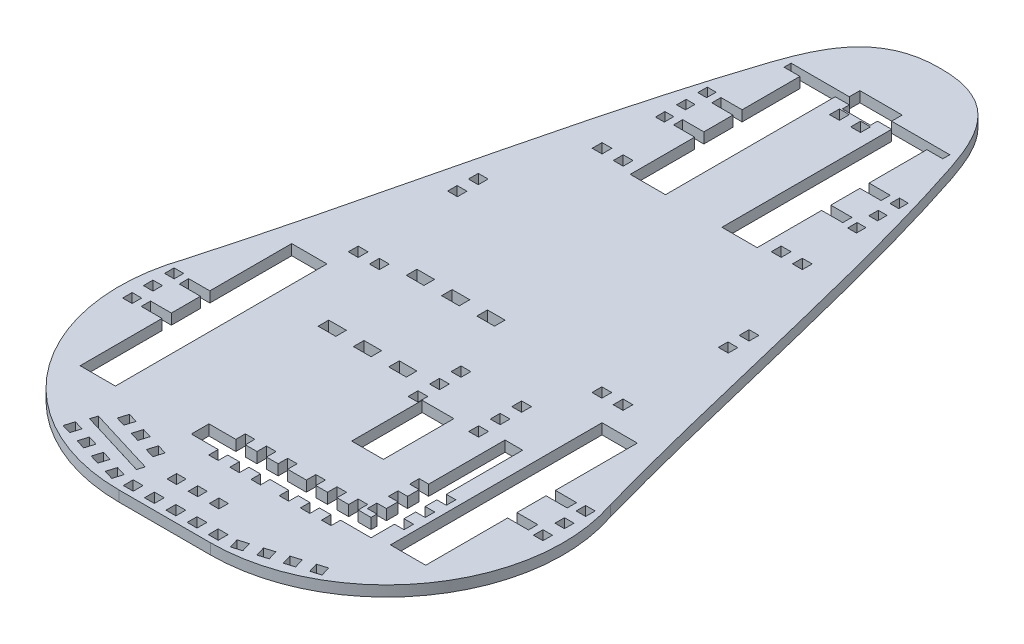
from build123d import *

# Parameters (mm, degrees)
SKETCH1_W           = 2.8
SKETCH1_H           = 2.8
SKETCH1_W_2         = 2.7
SKETCH1_H_2         = 2.7
SKETCH1_W_3         = 5
SKETCH1_H_3         = 3
SKETCH1_W_4         = 9
SKETCH1_H_4         = 20
SKETCH1_W_5         = 2.800000003
SKETCH1_H_5         = 2.800000033
SKETCH1_W_6         = 2.5
BOSS_EXTRUDE1_DEPTH = 3


with BuildPart() as part:
    # Sketch1 → Boss-Extrude1 (new body)
    with BuildSketch(Plane(origin=(0, 0, 0), x_dir=(1, 0, 0), z_dir=(0, 1, 0))):
        with BuildLine():
            ThreePointArc((-5.451969155, 56.808087392), (1.269227402, 11.627256864), (41.903464762, -9.237562441))
            Line((41.903464762, -9.237562441), (44.871962037, -9.237562441))
            Line((44.871962037, -9.237562441), (54.871962037, -9.237562441))
            Line((54.871962037, -9.237562441), (64.871962037, -9.237562441))
            Line((64.871962037, -9.237562441), (67.840459312, -9.237562441))
            ThreePointArc((67.840459312, -9.237562441), (108.474696672, 11.627256864), (115.195893229, 56.808087392))
            add(Edge.make_bspline(
                [(54.871962037, 210.762437559), (55.761906822, 210.762437559), (73.060866, 210.353019152), (83.092202828, 181.760771438), (97.272204063, 130.317751313), (107.073407346, 85.556993843), (115.195893229, 56.808087392)],
                knots=[0, 0, 0, 0, 0.011071988, 0.221439755, 0.460221349, 1, 1, 1, 1], degree=3))
            add(Edge.make_bspline(
                [(54.871962037, 210.762437559), (53.982017252, 210.762437559), (36.683058074, 210.353019152), (26.651721246, 181.760771438), (12.471720011, 130.317751313), (2.670516728, 85.556993843), (-5.451969155, 56.808087392)],
                knots=[0, 0, 0, 0, 0.011071988, 0.221439755, 0.460221349, 1, 1, 1, 1], degree=3))
        make_face()
        Polygon((18.148901926, -1.344832715), (18.967542699, 1.332820601), (21.645196015, 0.514179828), (20.826555242, -2.163473489), align=None, mode=Mode.SUBTRACT)
        Polygon((23.886730461, -3.099062944), (24.705371235, -0.421409627), (27.383024551, -1.2400504), (26.564383778, -3.917703717), align=None, mode=Mode.SUBTRACT)
        Polygon((20.227179715, 4.084786187), (20.811923125, 5.997395699), (39.938018244, 0.149961605), (39.353274835, -1.762647907), align=None, mode=Mode.SUBTRACT)
        Polygon((30.44319977, -2.175639855), (33.120853087, -2.994280629), (32.302212314, -5.671933945), (29.624558997, -4.853293172), align=None, mode=Mode.SUBTRACT)
        Polygon((38.858681623, -4.748510857), (38.04004085, -7.426164174), (35.362387533, -6.6075234), (36.181028306, -3.929870084), align=None, mode=Mode.SUBTRACT)
        Polygon((23.984169653, 8.164617876), (24.802810426, 10.842271193), (27.480463743, 10.023630419), (26.66182297, 7.345977103), align=None, mode=Mode.SUBTRACT)
        Polygon((29.721998189, 6.410387647), (30.540638962, 9.088040964), (33.218292279, 8.269400191), (32.399651506, 5.591746874), align=None, mode=Mode.SUBTRACT)
        Polygon((36.6609894, 7.216862054), (39.338642717, 6.398221281), (38.520001944, 3.720567964), (35.842348627, 4.539208737), align=None, mode=Mode.SUBTRACT)
        with Locations((42.821962037, -6.137562811)):
            Rectangle(SKETCH1_W, SKETCH1_H, mode=Mode.SUBTRACT)
        with Locations((48.821962037, -6.137562811)):
            Rectangle(SKETCH1_W, SKETCH1_H, mode=Mode.SUBTRACT)
        with Locations((47.371962075, 1.612437189)):
            Rectangle(SKETCH1_W_2, SKETCH1_H_2, mode=Mode.SUBTRACT)
        with Locations((53.371962075, 1.612437189)):
            Rectangle(SKETCH1_W_2, SKETCH1_H_2, mode=Mode.SUBTRACT)
        with Locations((-3.378903903, 39.762437559)):
            Rectangle(SKETCH1_W_2, SKETCH1_H_2, mode=Mode.SUBTRACT)
        with Locations((-3.478037963, 45.762437559)):
            Rectangle(SKETCH1_W_2, SKETCH1_H_2, mode=Mode.SUBTRACT)
        with Locations((-3.478037963, 51.762437559)):
            Rectangle(SKETCH1_W_2, SKETCH1_H_2, mode=Mode.SUBTRACT)
        Polygon((5.871962037, 52.537437559), (5.871962037, 75.762437559), (15.871962037, 75.762437559), (15.871962037, 15.762437559), (5.871962037, 15.762437559), (5.871962037, 38.987436182), (-0.028903903, 38.987436182), (-0.028903903, 41.637436182), (5.871962037, 41.637436182), (5.871962037, 49.887437559), (-0.128037963, 49.887437559), (-0.128037963, 52.537437559), align=None, mode=Mode.SUBTRACT)
        with Locations((17.32012911, 83.162436839)):
            Rectangle(SKETCH1_W, SKETCH1_H, mode=Mode.SUBTRACT)
        with Locations((23.32012911, 83.162436839)):
            Rectangle(SKETCH1_W, SKETCH1_H, mode=Mode.SUBTRACT)
        with Locations((32.421095947, 60.717167702)):
            Rectangle(SKETCH1_W_3, SKETCH1_H_3, mode=Mode.SUBTRACT)
        with Locations((42.421095947, 60.717167702)):
            Rectangle(SKETCH1_W_3, SKETCH1_H_3, mode=Mode.SUBTRACT)
        with Locations((52.421095947, 60.717167702)):
            Rectangle(SKETCH1_W_3, SKETCH1_H_3, mode=Mode.SUBTRACT)
        with Locations((54.921962037, -6.137563566)):
            Rectangle(SKETCH1_W, SKETCH1_H, mode=Mode.SUBTRACT)
        with Locations((60.921962037, -6.137562811)):
            Rectangle(SKETCH1_W, SKETCH1_H, mode=Mode.SUBTRACT)
        with Locations((59.371962075, 1.612437189)):
            Rectangle(SKETCH1_W_2, SKETCH1_H_2, mode=Mode.SUBTRACT)
        with Locations((66.921962037, -6.137562811)):
            Rectangle(SKETCH1_W, SKETCH1_H, mode=Mode.SUBTRACT)
        Polygon((71.703883225, -7.426164174), (70.885242451, -4.748510857), (73.562895768, -3.929870084), (74.381536541, -6.6075234), align=None, mode=Mode.SUBTRACT)
        Polygon((77.44171176, -5.671933945), (76.623070987, -2.994280629), (79.300724304, -2.175639855), (80.119365077, -4.853293172), align=None, mode=Mode.SUBTRACT)
        Polygon((82.360899523, -1.2400504), (85.03855284, -0.421409627), (85.857193613, -3.099062944), (83.179540296, -3.917703717), align=None, mode=Mode.SUBTRACT)
        Polygon((88.098728059, 0.514179828), (90.776381376, 1.332820601), (91.595022149, -1.344832715), (88.917368832, -2.163473489), align=None, mode=Mode.SUBTRACT)
        Polygon((80.721962037, 19.762437559), (84.371962037, 19.762437559), (84.371962037, 21.412437559), (81.671962037, 21.412437559), (81.671962037, 24.112437559), (84.371962037, 24.112437559), (84.371962037, 27.412437559), (81.671962037, 27.412437559), (81.671962037, 30.112437559), (84.371962037, 30.112437559), (84.371962037, 33.412437559), (81.671962037, 33.412437559), (81.671962037, 36.112437559), (84.371962037, 36.112437559), (84.371962037, 57.762437559), (89.371962037, 57.762437559), (89.371962037, 36.112437559), (92.071962037, 36.112437559), (92.071962037, 33.412437559), (89.371962037, 33.412437559), (89.371962037, 30.112437559), (92.071962037, 30.112437559), (92.071962037, 27.412437559), (89.371962037, 27.412437559), (89.371962037, 24.112437559), (92.071962037, 24.112437559), (92.071962037, 21.412437559), (89.371962037, 21.412437559), (89.371962037, 19.762437559), (89.371962037, 14.762437559), (84.371962037, 14.762437559), (80.721962037, 14.762437559), (80.721962037, 12.062437559), (78.021962037, 12.062437559), (78.021962037, 14.762437559), (74.721962037, 14.762437559), (74.721962037, 12.062437559), (72.021962037, 12.062437559), (72.021962037, 14.762437559), (68.721962037, 14.762437559), (68.721962037, 12.062437559), (66.021962037, 12.062437559), (66.021962037, 14.762437559), (60.721962075, 14.762437559), (60.721962075, 12.062437559), (58.021962075, 12.062437559), (58.021962075, 14.762437559), (54.721962075, 14.762437559), (54.721962075, 12.062437559), (52.021962075, 12.062437559), (52.021962075, 14.762437559), (48.721962075, 14.762437559), (48.721962075, 12.062437559), (46.021962075, 12.062437559), (46.021962075, 14.762437559), (42.371962037, 14.762437559), (38.41083117, 14.762437559), (38.41083117, 19.762437559), (42.371962037, 19.762437559), (46.021962075, 19.762437559), (46.021962075, 22.462437559), (48.721962075, 22.462437559), (48.721962075, 19.762437559), (52.021962075, 19.762437559), (52.021962075, 22.462437559), (54.721962075, 22.462437559), (54.721962075, 19.762437559), (58.021962075, 19.762437559), (58.021962075, 22.462437559), (60.721962075, 22.462437559), (60.721962075, 19.762437559), (66.021962037, 19.762437559), (66.021962037, 22.462437559), (68.721962037, 22.462437559), (68.721962037, 19.762437559), (72.021962037, 19.762437559), (72.021962037, 22.462437559), (74.721962037, 22.462437559), (74.721962037, 19.762437559), (78.021962037, 19.762437559), (78.021962037, 22.462437559), (80.721962037, 22.462437559), align=None, mode=Mode.SUBTRACT)
        with Locations((67.371962037, 45.762437559)):
            Rectangle(SKETCH1_W_4, SKETCH1_H_4, mode=Mode.SUBTRACT)
        with Locations((61.321095984, 56.117167438)):
            Rectangle(SKETCH1_W, SKETCH1_H, mode=Mode.SUBTRACT)
        with Locations((61.321095986, 62.217167405)):
            Rectangle(SKETCH1_W_5, SKETCH1_H, mode=Mode.SUBTRACT)
        with Locations((61.321095986, 68.317167422)):
            Rectangle(SKETCH1_W_5, SKETCH1_H_5, mode=Mode.SUBTRACT)
        with Locations((78.521095987, 56.117167438)):
            Rectangle(SKETCH1_W, SKETCH1_H, mode=Mode.SUBTRACT)
        with Locations((78.521095987, 62.217167405)):
            Rectangle(SKETCH1_W, SKETCH1_H, mode=Mode.SUBTRACT)
        with Locations((78.521095987, 68.317167422)):
            Rectangle(SKETCH1_W, SKETCH1_H_5, mode=Mode.SUBTRACT)
        Polygon((103.871962037, 38.987436182), (103.871962037, 15.762437559), (93.871962037, 15.762437559), (93.871962037, 75.762437559), (103.871962037, 75.762437559), (103.871962037, 52.537437559), (109.871962037, 52.537437559), (109.871962037, 49.887437559), (103.871962037, 49.887437559), (103.871962037, 41.637436182), (109.772827977, 41.637436182), (109.772827977, 38.987436182), align=None, mode=Mode.SUBTRACT)
        with Locations((113.122827977, 39.762437559)):
            Rectangle(SKETCH1_W_2, SKETCH1_H_2, mode=Mode.SUBTRACT)
        with Locations((113.221962037, 45.762437559)):
            Rectangle(SKETCH1_W_2, SKETCH1_H_2, mode=Mode.SUBTRACT)
        with Locations((113.221962037, 51.762437559)):
            Rectangle(SKETCH1_W_2, SKETCH1_H_2, mode=Mode.SUBTRACT)
        with Locations((86.423794964, 83.162436839)):
            Rectangle(SKETCH1_W, SKETCH1_H, mode=Mode.SUBTRACT)
        with Locations((92.423794964, 83.162436839)):
            Rectangle(SKETCH1_W, SKETCH1_H, mode=Mode.SUBTRACT)
        with Locations((16.471962037, 112.112437559)):
            Rectangle(SKETCH1_W, SKETCH1_H_2, mode=Mode.SUBTRACT)
        with Locations((16.47292877, 118.062437559)):
            Rectangle(SKETCH1_W, SKETCH1_H, mode=Mode.SUBTRACT)
        with Locations((32.421095947, 85.717167702)):
            Rectangle(SKETCH1_W_3, SKETCH1_H_3, mode=Mode.SUBTRACT)
        with Locations((42.421095947, 85.717167702)):
            Rectangle(SKETCH1_W_3, SKETCH1_H_3, mode=Mode.SUBTRACT)
        with Locations((52.421095947, 85.717167702)):
            Rectangle(SKETCH1_W_3, SKETCH1_H_3, mode=Mode.SUBTRACT)
        with Locations((26.471962037, 143.162923762)):
            Rectangle(SKETCH1_W, SKETCH1_H, mode=Mode.SUBTRACT)
        with Locations((32.471962037, 143.162437559)):
            Rectangle(SKETCH1_W, SKETCH1_H, mode=Mode.SUBTRACT)
        with Locations((27.621962037, 159.762437559)):
            Rectangle(SKETCH1_W_6, SKETCH1_H_2, mode=Mode.SUBTRACT)
        with Locations((27.621962037, 165.762437559)):
            Rectangle(SKETCH1_W_6, SKETCH1_H_2, mode=Mode.SUBTRACT)
        with Locations((27.621962037, 171.762437559)):
            Rectangle(SKETCH1_W_6, SKETCH1_H_2, mode=Mode.SUBTRACT)
        Polygon((50.471962037, 183.679368755), (50.473853225, 186.479368116), (53.271962037, 186.479368755), (53.271962037, 183.679368755), align=None, mode=Mode.SUBTRACT)
        with Locations((77.271962037, 143.162437559)):
            Rectangle(SKETCH1_W, SKETCH1_H, mode=Mode.SUBTRACT)
        with Locations((83.271962037, 143.162923762)):
            Rectangle(SKETCH1_W, SKETCH1_H, mode=Mode.SUBTRACT)
        with Locations((93.271962037, 112.112437559)):
            Rectangle(SKETCH1_W, SKETCH1_H_2, mode=Mode.SUBTRACT)
        with Locations((93.270995304, 118.062437559)):
            Rectangle(SKETCH1_W, SKETCH1_H, mode=Mode.SUBTRACT)
        Polygon((36.871962037, 172.487437559), (36.871962037, 188.883995744), (32.371962037, 188.883995744), (32.371962037, 190.883995744), (48.871962037, 190.883995744), (48.871962037, 193.883995744), (60.871962037, 193.883995744), (60.871962037, 190.883995744), (77.371962037, 190.883995744), (77.371962037, 188.883995744), (72.871962037, 188.883995744), (72.871962037, 172.487437559), (78.871962037, 172.487437559), (78.871962037, 169.887437559), (72.871962037, 169.887437559), (72.871962037, 161.637437559), (78.871962037, 161.637437559), (78.871962037, 159.037437559), (72.871962037, 159.037437559), (72.871962037, 140.762437559), (62.871962037, 140.762437559), (62.871962037, 188.883995744), (58.871962037, 188.883995744), (58.871962037, 186.883995744), (50.871962037, 186.883995744), (50.871962037, 188.883995744), (46.871962037, 188.883995744), (46.871962037, 140.762437559), (36.871962037, 140.762437559), (36.871962037, 159.037437559), (30.871962037, 159.037437559), (30.871962037, 161.637437559), (36.871962037, 161.637437559), (36.871962037, 169.887437559), (30.871962037, 169.887437559), (30.871962037, 172.487437559), align=None, mode=Mode.SUBTRACT)
        with Locations((82.121962037, 159.762437559)):
            Rectangle(SKETCH1_W_6, SKETCH1_H_2, mode=Mode.SUBTRACT)
        with Locations((82.121962037, 165.762437559)):
            Rectangle(SKETCH1_W_6, SKETCH1_H_2, mode=Mode.SUBTRACT)
        with Locations((82.121962037, 171.762437559)):
            Rectangle(SKETCH1_W_6, SKETCH1_H_2, mode=Mode.SUBTRACT)
        Polygon((56.471962037, 183.679368755), (56.471962037, 186.479368755), (59.27007085, 186.479368116), (59.271962037, 183.679368755), align=None, mode=Mode.SUBTRACT)
    extrude(amount=BOSS_EXTRUDE1_DEPTH)


solid = part.part
